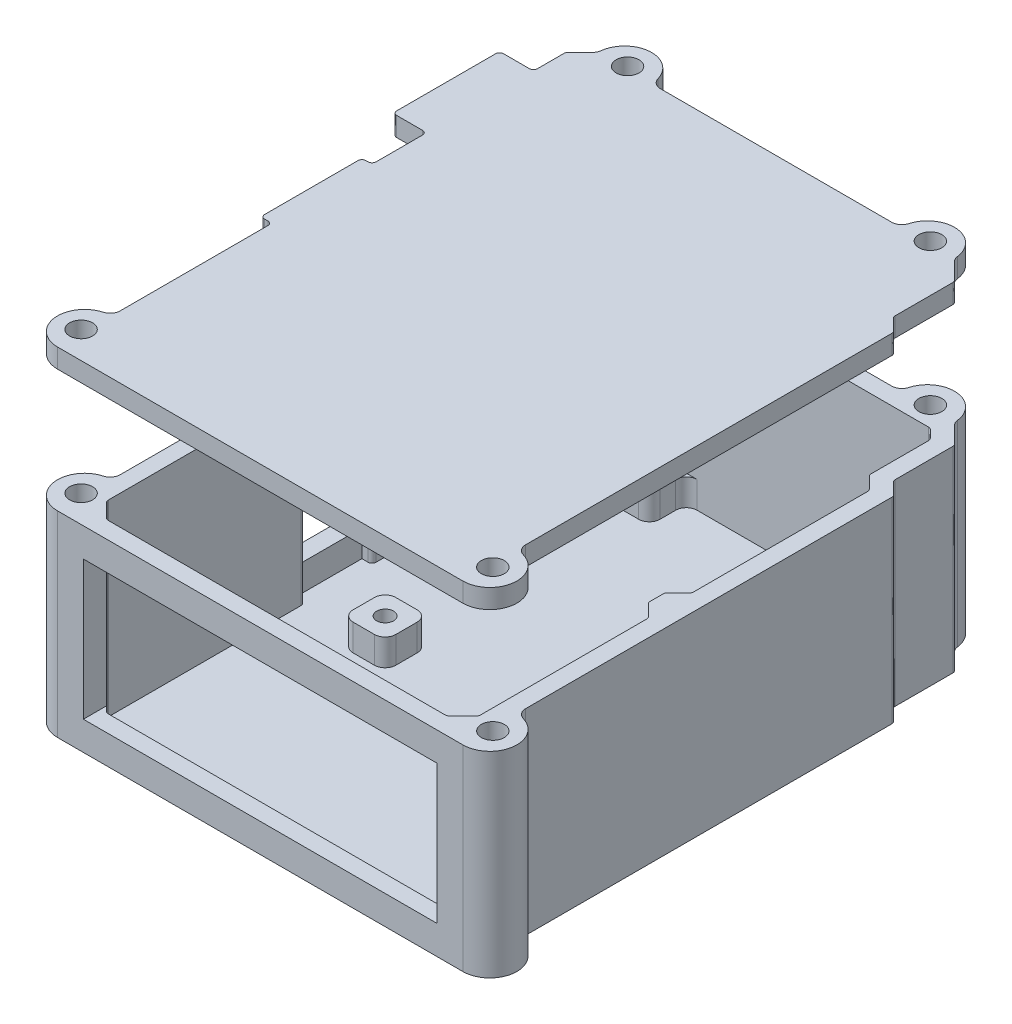
from build123d import *

# Parameters (mm, degrees)
BOSS_EXTRUDE1_DEPTH            = 1.600000102
BOSS_EXTRUDE2_START            = 1.6
BOSS_EXTRUDE2_DEPTH            = 35.199999704
SKETCH7_W                      = 7.60000004
SKETCH7_H                      = 7.60000004
SKETCH7_W_2                    = 8.000000002
SKETCH7_H_2                    = 8.000000002
BOSS_EXTRUDE4_DEPTH            = 4.999999906
SKETCH2_R                      = 1.5875
CUT_EXTRUDE3_DEPTH             = 100.287884374
CUT_EXTRUDE1_START             = -7.64499995
CUT_EXTRUDE1_OUTLINE_W         = 13.630000172
CUT_EXTRUDE1_OUTLINE_H         = 12.599999946
CUT_EXTRUDE1_OUTLINE_W_2       = 12.59000022
CUT_EXTRUDE1_DEPTH             = 7.64499995
FILLET1_R                      = 2.000000064
CHAMFER2_SIZE                  = 3
CHAMFER2_SIZE_2                = 2.631851771
CUT_EXTRUDE6_DEPTH             = 2.50000008
FILLET4_R                      = 0.75
CUT_EXTRUDE9_REACH             = 129.607
SKETCH21_W                     = 66.299999918
SKETCH21_H                     = 26.00999998
CUT_EXTRUDE9_DIRECTION_2_DEPTH = 2.54
SKETCH23_R                     = 2.150000018
BOSS_EXTRUDE14_DEPTH           = 36.799999806
CUT_EXTRUDE10_START            = -36.8
CUT_EXTRUDE10_DEPTH            = 10.000000066
FILLET5_R                      = 1.905
SKETCH24_R                     = 2.150000018
BOSS_EXTRUDE15_DEPTH           = 1.199999886
BOSS_EXTRUDE16_DEPTH           = 4.800000052
BOSS_EXTRUDE17_START           = -2.400000026
BOSS_EXTRUDE17_OUTLINE_R       = 2.150000018
BOSS_EXTRUDE17_DEPTH           = 2.400000026
FILLET6_R                      = 1.27


with BuildPart() as part:
    # Sketch3 → Boss-Extrude1 (new body)
    with BuildSketch(Plane(origin=(0, 0, 0), x_dir=(1, 0, 0), z_dir=(0, 1, 0))):
        Polygon((72.38000002, -41.29999995), (72.38000002, 3.505988455), (72.38000002, 39.420011545), (69.84000002, 41.960011545), (69.84000002, 53.390011545), (66.090011545, 57.14000002), (-3.80000002, 57.14000002), (-3.80000002, 48.115000036), (-10.15000002, 48.115000036), (-10.15000002, 28.084999964), (-3.80000002, 28.084999964), (-3.80000002, 17.865000084), (-5.70500002, 17.865000084), (-5.70500002, -1.125000036), (-3.595726125, -1.125000036), (-3.595726125, -41.29999995), align=None)
    extrude(amount=BOSS_EXTRUDE1_DEPTH)

    # Sketch3<3> → Boss-Extrude2 (add)
    with BuildSketch(Plane(origin=(0, 0, 0), x_dir=(1, 0, 0), z_dir=(0, 1, 0)).offset(BOSS_EXTRUDE2_START)):
        Polygon((72.38000002, 3.505988455), (72.38000002, -41.29999995), (-3.595726125, -41.29999995), (-3.595726125, -1.125000036), (-5.70500002, -1.125000036), (-5.70500002, 17.865000084), (-3.80000002, 17.865000084), (-3.80000002, 28.084999964), (-10.15000002, 28.084999964), (-10.15000002, 48.115000036), (-3.80000002, 48.115000036), (-3.80000002, 57.14000002), (66.090011545, 57.14000002), (69.84000002, 53.390011545), (69.84000002, 41.960011545), (72.38000002, 39.420011545), align=None)
        Polygon((69.18000007, -0.315998005), (69.18000007, -38.1), (-0.60000007, -38.1), (-0.60000007, 0), (-0.60000007, 2.074999914), (-2.50500007, 2.074999914), (-2.50500007, 14.665000134), (-0.60000007, 14.665000134), (-0.60000007, 31.284999914), (-6.95000007, 31.284999914), (-6.95000007, 44.915000086), (-0.60000007, 44.915000086), (-0.60000007, 53.94000007), (64.764528166, 53.94000007), (66.64000007, 52.064528166), (66.64000007, 40.634528166), (69.18000007, 38.094528166), (69.18000007, 4.831471834), (66.64000007, 2.291471834), (66.64000007, 0), (66.64000007, -0.705067354), align=None, mode=Mode.SUBTRACT)
    extrude(amount=BOSS_EXTRUDE2_DEPTH)

    # Sketch7 → Boss-Extrude4 (add)
    with BuildSketch(Plane(origin=(0, 1.600000102, 0), x_dir=(1, 0, 0), z_dir=(0, 1, 0))):
        with Locations((15.24, 50.8)):
            Rectangle(SKETCH7_W, SKETCH7_H)
        with Locations((66.04, 35.56)):
            Rectangle(SKETCH7_W_2, SKETCH7_H_2)
        with Locations((66.04, 7.62)):
            Rectangle(SKETCH7_W_2, SKETCH7_H_2)
        with Locations((13.97, 2.54)):
            Rectangle(SKETCH7_W_2, SKETCH7_H_2)
    extrude(amount=BOSS_EXTRUDE4_DEPTH)

    # Sketch2 → Cut-Extrude3 (cut, through all)
    with BuildSketch(Plane(origin=(0, 0, 0), x_dir=(1, 0, 0), z_dir=(0, 1, 0))):
        with Locations(Location((13.97, 2.54, 0), (0, 0, 90))):
            Circle(SKETCH2_R)
        with Locations(Location((15.24, 50.8, 0), (0, 0, 270))):
            Circle(SKETCH2_R)
        with Locations(Location((66.04, 35.56, 0), (0, 0, 90))):
            Circle(SKETCH2_R)
        with Locations(Location((66.04, 7.62, 0), (0, 0, 270))):
            Circle(SKETCH2_R)
    extrude(amount=CUT_EXTRUDE3_DEPTH, mode=Mode.SUBTRACT)

    # Cut-Extrude1: read off the stored shape, not the designer's step
    # Cut-Extrude1 outline → Cut-Extrude1 (cut)
    with BuildSketch(Plane(origin=(-2.50500007, 0, 0), x_dir=(0, 0, -1), z_dir=(1, 0, 0)).offset(CUT_EXTRUDE1_START)):
        with Locations((38.1, 12.899999981)):
            Rectangle(CUT_EXTRUDE1_OUTLINE_W, CUT_EXTRUDE1_OUTLINE_H)
        with Locations((8.370000024, 12.899999981)):
            Rectangle(CUT_EXTRUDE1_OUTLINE_W_2, CUT_EXTRUDE1_OUTLINE_H)
    extrude(amount=CUT_EXTRUDE1_DEPTH, mode=Mode.SUBTRACT)

    # Fillet1
    # the kernel refuses this fillet: 2.000000064 mm, written as the material it adds along each edge
    with BuildSketch(Plane(origin=(69.18000007, 1.600000102, -31.559999999), x_dir=(0, 0, 1), z_dir=(0, 1, 0))) as fillet1_piece_1:
        with BuildLine():
            CenterArc((FILLET1_R, -FILLET1_R), FILLET1_R, 90, 90)
            Line((0, -FILLET1_R), (0, 0))
            Line((0, 0), (FILLET1_R, 0))
        make_face()
    extrude(amount=4.999999906)
    with BuildSketch(Plane(origin=(69.18000007, 1.600000102, -11.620000001), x_dir=(0, 0, -1), z_dir=(0, 1, 0)), Plane(origin=(19.04000002, 6.600000008, -53.94000007), x_dir=(1, 0, 0), z_dir=(0, -1, 0)), Plane(origin=(11.43999998, 1.600000102, -53.94000007), x_dir=(-1, 0, 0), z_dir=(0, 1, 0))) as fillet1_piece_2:
        with BuildLine():
            CenterArc((FILLET1_R, FILLET1_R), FILLET1_R, 180, 90)
            Line((0, FILLET1_R), (0, 0))
            Line((0, 0), (FILLET1_R, 0))
        make_face()
    extrude(amount=4.999999906)
    with BuildSketch(Plane(origin=(67.968528235, 6.600000008, -3.619999999), x_dir=(-0.7071067811877789, 0, 0.707106781185316), z_dir=(0, -1, 0))) as fillet1_piece_3:
        with BuildLine():
            CenterArc((3.685752081, 0.857324866), FILLET1_R, 135, 70.382703807)
            Line((2.271538473, 2.271538473), (0, 0))
            Line((0, 0), (1.87882255, 0))
        make_face()
    extrude(amount=4.999999906)
    with BuildSketch(Plane(origin=(67.714528235, 6.600000008, -39.560000001), x_dir=(-0.7071067811865499, 0, -0.7071067811865452), z_dir=(0, -1, 0))) as fillet1_piece_4:
        with BuildLine():
            CenterArc((3.427714703, -0.599287488), FILLET1_R, 162.563793754, 62.436206246)
            Line((2.013501095, -2.013501095), (0, 0))
            Line((0, 0), (1.519612305, 0))
        make_face()
    extrude(amount=4.999999906)
    # the kernel refuses this fillet: 2.000000064 mm, written as the material it takes off along each edge
    with BuildSketch(Plane(origin=(19.04000002, 1.600000102, -46.99999998), x_dir=(0, 0, -1), z_dir=(0, 1, 0)), Plane(origin=(11.43999998, 1.600000102, -46.99999998), x_dir=(1, 0, 0), z_dir=(0, 1, 0)), Plane(origin=(9.969999999, 1.600000102, -6.540000001), x_dir=(0, 0, 1), z_dir=(0, 1, 0)), Plane(origin=(62.039999999, 1.600000102, -3.619999999), x_dir=(1, 0, 0), z_dir=(0, 1, 0)), Plane(origin=(62.039999999, 1.600000102, -11.620000001), x_dir=(0, 0, 1), z_dir=(0, 1, 0)), Plane(origin=(62.039999999, 1.600000102, -31.559999999), x_dir=(1, 0, 0), z_dir=(0, 1, 0)), Plane(origin=(9.969999999, 1.600000102, 1.460000001), x_dir=(1, 0, 0), z_dir=(0, 1, 0))) as fillet1_2_piece_1:
        with BuildLine():
            CenterArc((FILLET1_R, FILLET1_R), FILLET1_R, 180, 90)
            Line((0, FILLET1_R), (0, 0))
            Line((0, 0), (FILLET1_R, 0))
        make_face()
    extrude(amount=10.000000066, mode=Mode.SUBTRACT)
    with BuildSketch(Plane(origin=(17.970000001, 1.600000102, -6.540000001), x_dir=(0, 0, 1), z_dir=(0, 1, 0)), Plane(origin=(62.039999999, 1.600000102, -39.560000001), x_dir=(1, 0, 0), z_dir=(0, 1, 0)), Plane(origin=(17.970000001, 1.600000102, 1.460000001), x_dir=(-1, 0, 0), z_dir=(0, 1, 0))) as fillet1_2_piece_2:
        with BuildLine():
            CenterArc((FILLET1_R, -FILLET1_R), FILLET1_R, 90, 90)
            Line((0, -FILLET1_R), (0, 0))
            Line((0, 0), (FILLET1_R, 0))
        make_face()
    extrude(amount=10.000000066, mode=Mode.SUBTRACT)

    # Chamfer2
    # the kernel refuses this chamfer: 3, 2.631851771 mm, written as the material it adds along each edge
    with BuildSketch(Plane(origin=(-0.60000007, -6.115048964, 38.1), x_dir=(0, 0, -1), z_dir=(0, 1, 0))) as chamfer2_piece_1_section:
        Polygon((CHAMFER2_SIZE, 0), (0, -CHAMFER2_SIZE), (0, 0), align=None)
    chamfer2_piece_1 = extrude(amount=42.915048668, mode=Mode.PRIVATE)
    chamfer2_piece_1 = split(chamfer2_piece_1, bisect_by=Plane(origin=(-0.60000007, 1.600000102, 38.1), z_dir=(0, 1, 0)), keep=Keep.TOP, mode=Mode.PRIVATE)
    add(chamfer2_piece_1)
    with BuildSketch(Plane(origin=(69.18000007, -6.115048964, 38.1), x_dir=(0, 0, -1), z_dir=(0, 1, 0))) as chamfer2_piece_2_section:
        Polygon((CHAMFER2_SIZE, 0), (0, CHAMFER2_SIZE), (0, 0), align=None)
    chamfer2_piece_2 = extrude(amount=42.915048668, mode=Mode.PRIVATE)
    chamfer2_piece_2 = split(chamfer2_piece_2, bisect_by=Plane(origin=(69.18000007, 1.600000102, 38.1), z_dir=(0, 1, 0)), keep=Keep.TOP, mode=Mode.PRIVATE)
    add(chamfer2_piece_2)
    with BuildSketch(Plane(origin=(69.18000007, -6.115048964, 0.315998005), x_dir=(0, 0, 1), z_dir=(0, 1, 0))) as chamfer2_piece_3_section:
        Polygon((CHAMFER2_SIZE, 0), (CHAMFER2_SIZE_2 * 0.151410918199, -CHAMFER2_SIZE_2 * 0.988470906855), (0, 0), align=None)
    chamfer2_piece_3 = extrude(amount=42.915048668, mode=Mode.PRIVATE)
    chamfer2_piece_3 = split(chamfer2_piece_3, bisect_by=Plane(origin=(69.18000007, 1.600000102, 0.315998005), z_dir=(0, 1, 0)), keep=Keep.TOP, mode=Mode.PRIVATE)
    chamfer2_piece_3 = split(chamfer2_piece_3, bisect_by=Plane(origin=(66.64000007, -6.115048964, 0.315998005), z_dir=(1, 0, 0)), keep=Keep.TOP, mode=Mode.PRIVATE)
    add(chamfer2_piece_3)
    # the kernel refuses this chamfer: 3, 2.631851771 mm, written as the material it takes off along each edge
    with BuildSketch(Plane(origin=(-3.80000002, -7.715048964, -57.14000002), x_dir=(0, 0, 1), z_dir=(0, 1, 0))) as chamfer2_2_piece_1:
        Polygon((CHAMFER2_SIZE, 0), (0, CHAMFER2_SIZE), (0, 0), align=None)
    extrude(amount=52.230097632, mode=Mode.SUBTRACT)

    # Sketch15 → Cut-Extrude6 (cut)
    with BuildSketch(Plane.XZ):
        Polygon((13.97, 0.60655898), (11.244999989, -0.96672051), (11.244999989, -4.11327949), (13.97, -5.68655898), (16.695000011, -4.11327949), (16.695000011, -0.96672051), align=None)
        Polygon((66.04, -4.47344102), (63.314999989, -6.04672051), (63.314999989, -9.19327949), (66.04, -10.76655898), (68.765000011, -9.19327949), (68.765000011, -6.04672051), align=None)
        Polygon((66.04, -32.41344102), (63.314999989, -33.98672051), (63.314999989, -37.13327949), (66.04, -38.70655898), (68.765000011, -37.13327949), (68.765000011, -33.98672051), align=None)
        Polygon((15.24, -47.65344102), (12.514999989, -49.22672051), (12.514999989, -52.37327949), (15.24, -53.94655898), (17.965000011, -52.37327949), (17.965000011, -49.22672051), align=None)
    extrude(amount=-CUT_EXTRUDE6_DEPTH, mode=Mode.SUBTRACT)

    # Fillet4
    fillet4_edges = [part.edges().sort_by_distance(p)[0] for p in [
        (-3.595726125, 18.399999852, 1.125000036),
        (-5.70500002, 18.399999852, 1.125000036),
        (-5.70500002, 18.399999852, -17.865000084),
        (-3.80000002, 18.399999852, -17.865000084),
        (-3.80000002, 18.399999852, -28.084999964),
        (-10.15000002, 18.399999852, -28.084999964),
        (-10.15000002, 18.399999852, -48.115000036),
        (-3.80000002, 18.399999852, -48.115000036),
        (69.84000002, 18.399999852, -53.390011545),
        (69.84000002, 18.399999852, -41.960011545),
        (72.38000002, 18.399999852, -39.420011545),
        (-3.80000002, 18.399999852, -54.14000002),
        (69.18000007, 19.199999903, 35.1),
        (69.18000007, 19.199999903, 3.315998005),
        (2.39999993, 19.199999903, 38.1),
        (66.18000007, 19.199999903, 38.1),
        (-0.60000007, 19.199999903, 35.1),
        (66.64000007, 19.199999903, 0.775998005),
        (66.64000007, 21.699999856, -2.291471834),
        (69.18000007, 21.699999856, -4.831471834),
        (69.18000007, 21.699999856, -38.094528166),
        (66.64000007, 21.699999856, -40.634528166),
        (66.64000007, 19.199999852, -52.064528166),
        (64.764528166, 19.199999852, -53.94000007),
        (-0.60000007, 19.199999852, -53.94000007),
        (-0.60000007, 19.199999852, -44.915000086),
        (-0.60000007, 19.199999852, -31.284999914),
        (-0.60000007, 19.199999852, -14.665000134),
        (-0.60000007, 19.199999852, -2.074999914),
    ]]
    fillet(fillet4_edges, radius=FILLET4_R)

    # Sketch21 → Cut-Extrude9 (cut, up to next)
    with BuildSketch(Plane.XY.offset(41.29999995), mode=Mode.PRIVATE) as cut_extrude9_sk1:
        with Locations((34.392136947, 18.399999903)):
            Rectangle(SKETCH21_W, SKETCH21_H)
    cut_extrude9_tool1 = extrude(cut_extrude9_sk1.sketch, amount=-CUT_EXTRUDE9_REACH, mode=Mode.PRIVATE) & part.part
    add(cut_extrude9_tool1.solids().sort_by_distance((34.392137, 18.4, 41.3))[0], mode=Mode.SUBTRACT)

    # Sketch21 → Cut-Extrude9 direction 2 (cut)
    with BuildSketch(Plane.XY.offset(41.29999995)):
        with Locations((34.392136947, 18.399999903)):
            Rectangle(SKETCH21_W, SKETCH21_H)
    extrude(amount=CUT_EXTRUDE9_DIRECTION_2_DEPTH, mode=Mode.SUBTRACT)

    # Sketch23 → Boss-Extrude14 (add)
    with BuildSketch(Plane.XZ):
        with Locations((4.263000014, -57.690000063)):
            Circle(SKETCH23_R)
        with BuildLine():
            Line((-0.80000002, -57.14000002), (9.326000048, -57.14000002))
            ThreePointArc((9.326000048, -57.14000002), (4.263000014, -62.203000054), (-0.80000002, -57.14000002))
        make_face()
        with BuildLine():
            ThreePointArc((6.34146099, -57.14000002), (4.263000014, -55.540000045), (2.184539038, -57.14000002))
            Line((2.184539038, -57.14000002), (6.34146099, -57.14000002))
        make_face()
        with BuildLine():
            Line((6.34146099, -57.14000002), (2.184539038, -57.14000002))
            ThreePointArc((2.184539038, -57.14000002), (3.985683461, -59.822040308), (6.413000032, -57.690000063))
            ThreePointArc((6.413000032, -57.690000063), (6.395040259, -57.41268351), (6.34146099, -57.14000002))
        make_face()
        with BuildLine():
            ThreePointArc((63.105472488, -57.14000002), (61.027011511, -55.540000045), (58.948550535, -57.14000002))
            Line((58.948550535, -57.14000002), (63.105472488, -57.14000002))
        make_face()
        with BuildLine():
            Line((63.105472488, -57.14000002), (58.948550535, -57.14000002))
            ThreePointArc((58.948550535, -57.14000002), (60.749694959, -59.822040308), (63.177011529, -57.690000063))
            ThreePointArc((63.177011529, -57.690000063), (63.159051756, -57.41268351), (63.105472488, -57.14000002))
        make_face()
        with Locations((61.027011511, -57.690000063)):
            Circle(SKETCH23_R)
        with BuildLine():
            Line((55.964011477, -57.14000002), (66.090011545, -57.14000002))
            ThreePointArc((66.090011545, -57.14000002), (61.027011511, -62.203000054), (55.964011477, -57.14000002))
        make_face()
        with BuildLine():
            ThreePointArc((75.080000081, 36.236999916), (74.241487763, 37.940672446), (72.38000002, 38.315460892))
            Line((72.38000002, 38.315460892), (72.38000002, 34.15853894))
            ThreePointArc((72.38000002, 34.15853894), (74.241487763, 34.533327386), (75.080000081, 36.236999916))
        make_face()
        with BuildLine():
            Line((72.38000002, 34.15853894), (72.38000002, 38.315460892))
            ThreePointArc((72.38000002, 38.315460892), (70.780000045, 36.236999916), (72.38000002, 34.15853894))
        make_face()
        with Locations((72.930000063, 36.236999916)):
            Circle(SKETCH23_R)
        with BuildLine():
            Line((72.38000002, 41.29999995), (72.38000002, 31.173999882))
            ThreePointArc((72.38000002, 31.173999882), (77.443000054, 36.236999916), (72.38000002, 41.29999995))
        make_face()
        with Locations((-4.247863116, 36.236999916)):
            Circle(SKETCH23_R)
        with BuildLine():
            Line((-3.595726125, 41.29999995), (-3.595726125, 31.173999882))
            ThreePointArc((-3.595726125, 31.173999882), (-8.658726159, 36.236999916), (-3.595726125, 41.29999995))
        make_face()
        with BuildLine():
            ThreePointArc((-2.097863098, 36.236999916), (-2.512266011, 37.505937569), (-3.595726125, 38.285711078))
            Line((-3.595726125, 38.285711078), (-3.595726125, 34.188288754))
            ThreePointArc((-3.595726125, 34.188288754), (-2.512266011, 34.968062263), (-2.097863098, 36.236999916))
        make_face()
        with BuildLine():
            Line((-3.595726125, 34.188288754), (-3.595726125, 38.285711078))
            ThreePointArc((-3.595726125, 38.285711078), (-6.397863134, 36.236999916), (-3.595726125, 34.188288754))
        make_face()
    extrude(amount=-BOSS_EXTRUDE14_DEPTH)

    # Sketch23<3> → Cut-Extrude10 (cut)
    with BuildSketch(Plane.XZ.offset(CUT_EXTRUDE10_START)):
        with BuildLine():
            ThreePointArc((6.34146099, -57.14000002), (4.263000014, -55.540000045), (2.184539038, -57.14000002))
            Line((2.184539038, -57.14000002), (6.34146099, -57.14000002))
        make_face()
        with BuildLine():
            Line((6.34146099, -57.14000002), (2.184539038, -57.14000002))
            ThreePointArc((2.184539038, -57.14000002), (3.985683461, -59.822040308), (6.413000032, -57.690000063))
            ThreePointArc((6.413000032, -57.690000063), (6.395040259, -57.41268351), (6.34146099, -57.14000002))
        make_face()
        with BuildLine():
            ThreePointArc((63.105472488, -57.14000002), (61.027011511, -55.540000045), (58.948550535, -57.14000002))
            Line((58.948550535, -57.14000002), (63.105472488, -57.14000002))
        make_face()
        with BuildLine():
            Line((63.105472488, -57.14000002), (58.948550535, -57.14000002))
            ThreePointArc((58.948550535, -57.14000002), (60.749694959, -59.822040308), (63.177011529, -57.690000063))
            ThreePointArc((63.177011529, -57.690000063), (63.159051756, -57.41268351), (63.105472488, -57.14000002))
        make_face()
        with BuildLine():
            ThreePointArc((75.080000081, 36.236999916), (74.241487763, 37.940672446), (72.38000002, 38.315460892))
            Line((72.38000002, 38.315460892), (72.38000002, 34.15853894))
            ThreePointArc((72.38000002, 34.15853894), (74.241487763, 34.533327386), (75.080000081, 36.236999916))
        make_face()
        with BuildLine():
            Line((72.38000002, 34.15853894), (72.38000002, 38.315460892))
            ThreePointArc((72.38000002, 38.315460892), (70.780000045, 36.236999916), (72.38000002, 34.15853894))
        make_face()
        with BuildLine():
            ThreePointArc((-2.097863098, 36.236999916), (-2.512266011, 37.505937569), (-3.595726125, 38.285711078))
            Line((-3.595726125, 38.285711078), (-3.595726125, 34.188288754))
            ThreePointArc((-3.595726125, 34.188288754), (-2.512266011, 34.968062263), (-2.097863098, 36.236999916))
        make_face()
        with BuildLine():
            Line((-3.595726125, 34.188288754), (-3.595726125, 38.285711078))
            ThreePointArc((-3.595726125, 38.285711078), (-6.397863134, 36.236999916), (-3.595726125, 34.188288754))
        make_face()
    extrude(amount=CUT_EXTRUDE10_DEPTH, mode=Mode.SUBTRACT)

    # Fillet5
    fillet5_edges = [part.edges().sort_by_distance(p)[0] for p in [
        (66.090011545, 18.399999852, -57.14000002),
        (-0.80000002, 18.399999852, -57.14000002),
        (9.326000048, 18.399999903, -57.14000002),
        (55.964011477, 18.399999903, -57.14000002),
        (72.38000002, 18.399999903, 31.173999882),
        (-3.595726125, 18.399999903, 31.173999882),
    ]]
    fillet(fillet5_edges, radius=FILLET5_R)


with BuildPart() as body_2:
    # Sketch24 → Boss-Extrude15 (new body)
    with BuildSketch(Plane(origin=(0, 62.199999806, 0), x_dir=(1, 0, 0), z_dir=(0, 1, 0))):
        with BuildLine():
            Line((-3.595726125, -41.29999995), (72.38000002, -41.29999995))
            ThreePointArc((72.38000002, -41.29999995), (77.394546314, -36.935780864), (73.76418702, -31.366887423))
            ThreePointArc((73.76418702, -31.366887423), (72.764938547, -30.682695728), (72.38000002, -29.534463122))
            Line((72.38000002, -29.534463122), (72.38000002, 39.109351374))
            ThreePointArc((72.38000002, 39.109351374), (72.322909669, 39.396363948), (72.160330106, 39.639681459))
            Line((72.160330106, 39.639681459), (70.059669934, 41.740341631))
            ThreePointArc((70.059669934, 41.740341631), (69.897090371, 41.983659143), (69.84000002, 42.270671717))
            Line((69.84000002, 42.270671717), (69.84000002, 53.079351374))
            ThreePointArc((69.84000002, 53.079351374), (69.782909669, 53.366363948), (69.620330106, 53.609681459))
            Line((69.620330106, 53.609681459), (66.597171076, 56.63284049))
            ThreePointArc((66.597171076, 56.63284049), (66.231445389, 57.145933993), (66.053098401, 57.750262192))
            ThreePointArc((66.053098401, 57.750262192), (61.421754355, 62.187588299), (56.156899018, 58.52418702))
            ThreePointArc((56.156899018, 58.52418702), (55.472707323, 57.524938547), (54.324474717, 57.14000002))
            Line((54.324474717, 57.14000002), (10.965536808, 57.14000002))
            ThreePointArc((10.965536808, 57.14000002), (9.817304202, 57.524938547), (9.133112507, 58.52418702))
            ThreePointArc((9.133112507, 58.52418702), (3.86825717, 62.187588299), (-0.763086876, 57.750262192))
            ThreePointArc((-0.763086876, 57.750262192), (-0.941433864, 57.145933993), (-1.30715955, 56.63284049))
            Line((-1.30715955, 56.63284049), (-3.580330106, 54.359669934))
            ThreePointArc((-3.580330106, 54.359669934), (-3.742909669, 54.116352422), (-3.80000002, 53.829339848))
            Line((-3.80000002, 53.829339848), (-3.80000002, 48.865000036))
            ThreePointArc((-3.80000002, 48.865000036), (-4.019669934, 48.33466995), (-4.55000002, 48.115000036))
            Line((-4.55000002, 48.115000036), (-9.40000002, 48.115000036))
            ThreePointArc((-9.40000002, 48.115000036), (-9.930330106, 47.895330122), (-10.15000002, 47.365000036))
            Line((-10.15000002, 47.365000036), (-10.15000002, 28.834999964))
            ThreePointArc((-10.15000002, 28.834999964), (-9.930330106, 28.304669878), (-9.40000002, 28.084999964))
            Line((-9.40000002, 28.084999964), (-4.55000002, 28.084999964))
            ThreePointArc((-4.55000002, 28.084999964), (-4.019669934, 27.86533005), (-3.80000002, 27.334999964))
            Line((-3.80000002, 27.334999964), (-3.80000002, 18.615000084))
            ThreePointArc((-3.80000002, 18.615000084), (-4.019669934, 18.084669998), (-4.55000002, 17.865000084))
            Line((-4.55000002, 17.865000084), (-4.95500002, 17.865000084))
            ThreePointArc((-4.95500002, 17.865000084), (-5.485330106, 17.64533017), (-5.70500002, 17.115000084))
            Line((-5.70500002, 17.115000084), (-5.70500002, -0.375000036))
            ThreePointArc((-5.70500002, -0.375000036), (-5.485330106, -0.905330122), (-4.95500002, -1.125000036))
            Line((-4.95500002, -1.125000036), (-4.345726125, -1.125000036))
            ThreePointArc((-4.345726125, -1.125000036), (-3.81539604, -1.34466995), (-3.595726125, -1.875000036))
            Line((-3.595726125, -1.875000036), (-3.595726125, -29.534463122))
            ThreePointArc((-3.595726125, -29.534463122), (-3.980664652, -30.682695728), (-4.979913126, -31.366887423))
            ThreePointArc((-4.979913126, -31.366887423), (-8.610272419, -36.935780864), (-3.595726125, -41.29999995))
        make_face()
        with Locations(Location((72.930000063, -36.236999916, 0), (0, 0, 270))):
            Circle(SKETCH24_R, mode=Mode.SUBTRACT)
        with Locations(Location((-4.247863116, -36.236999916, 0), (0, 0, 270))):
            Circle(SKETCH24_R, mode=Mode.SUBTRACT)
        with Locations(Location((61.027011511, 57.690000063, 0), (0, 0, 270))):
            Circle(SKETCH24_R, mode=Mode.SUBTRACT)
        with Locations(Location((4.263000014, 57.690000063, 0), (0, 0, 270))):
            Circle(SKETCH24_R, mode=Mode.SUBTRACT)
    extrude(amount=BOSS_EXTRUDE15_DEPTH)

    # Sketch24<3> → Boss-Extrude16 (add)
    with BuildSketch(Plane(origin=(0, 62.199999806, 0), x_dir=(1, 0, 0), z_dir=(0, 1, 0))):
        with BuildLine():
            Line((64.453867995, 53.64000007), (0.14999993, 53.64000007))
            ThreePointArc((0.14999993, 53.64000007), (-0.168198122, 53.508198122), (-0.30000007, 53.19000007))
            Line((-0.30000007, 53.19000007), (-0.30000007, 45.665000086))
            ThreePointArc((-0.30000007, 45.665000086), (-0.60753795, 44.922537966), (-1.35000007, 44.615000086))
            Line((-1.35000007, 44.615000086), (-6.65000007, 44.615000086))
            Line((-6.65000007, 44.615000086), (-6.65000007, 31.584999914))
            Line((-6.65000007, 31.584999914), (-1.35000007, 31.584999914))
            ThreePointArc((-1.35000007, 31.584999914), (-0.60753795, 31.277462034), (-0.30000007, 30.534999914))
            Line((-0.30000007, 30.534999914), (-0.30000007, 15.415000134))
            ThreePointArc((-0.30000007, 15.415000134), (-0.60753795, 14.672538014), (-1.35000007, 14.365000134))
            Line((-1.35000007, 14.365000134), (-2.20500007, 14.365000134))
            Line((-2.20500007, 14.365000134), (-2.20500007, 2.374999914))
            Line((-2.20500007, 2.374999914), (-1.35000007, 2.374999914))
            ThreePointArc((-1.35000007, 2.374999914), (-0.60753795, 2.067462034), (-0.30000007, 1.324999914))
            Line((-0.30000007, 1.324999914), (-0.30000007, -34.789339828))
            ThreePointArc((-0.30000007, -34.789339828), (-0.26574586, -34.961547373), (-0.168198122, -35.10753788))
            Line((-0.168198122, -35.10753788), (2.39246205, -37.668198052))
            ThreePointArc((2.39246205, -37.668198052), (2.538452557, -37.76574579), (2.710660102, -37.8))
            Line((2.710660102, -37.8), (65.869339898, -37.8))
            ThreePointArc((65.869339898, -37.8), (66.041547443, -37.76574579), (66.18753795, -37.668198052))
            Line((66.18753795, -37.668198052), (68.748198122, -35.10753788))
            ThreePointArc((68.748198122, -35.10753788), (68.84574586, -34.961547373), (68.88000007, -34.789339828))
            Line((68.88000007, -34.789339828), (68.88000007, -3.626658177))
            ThreePointArc((68.88000007, -3.626658177), (68.84574586, -3.454450632), (68.748198122, -3.308460126))
            Line((68.748198122, -3.308460126), (66.64753795, -1.207799954))
            ThreePointArc((66.64753795, -1.207799954), (66.419926561, -0.867155437), (66.34000007, -0.465337834))
            Line((66.34000007, -0.465337834), (66.34000007, 1.980811662))
            ThreePointArc((66.34000007, 1.980811662), (66.419926561, 2.382629266), (66.64753795, 2.723273782))
            Line((66.64753795, 2.723273782), (68.748198122, 4.823933954))
            ThreePointArc((68.748198122, 4.823933954), (68.84574586, 4.969924461), (68.88000007, 5.142132005))
            Line((68.88000007, 5.142132005), (68.88000007, 37.783867995))
            ThreePointArc((68.88000007, 37.783867995), (68.84574586, 37.956075539), (68.748198122, 38.102066046))
            Line((68.748198122, 38.102066046), (66.64753795, 40.202726218))
            ThreePointArc((66.64753795, 40.202726218), (66.419926561, 40.543370734), (66.34000007, 40.945188338))
            Line((66.34000007, 40.945188338), (66.34000007, 51.753867995))
            ThreePointArc((66.34000007, 51.753867995), (66.30574586, 51.926075539), (66.208198122, 52.072066046))
            Line((66.208198122, 52.072066046), (64.772066046, 53.508198122))
            ThreePointArc((64.772066046, 53.508198122), (64.626075539, 53.60574586), (64.453867995, 53.64000007))
        make_face()
        with BuildLine():
            Line((63.977522398, 52.04000007), (1.29999993, 52.04000007))
            Line((1.29999993, 52.04000007), (1.29999993, 45.665000086))
            ThreePointArc((1.29999993, 45.665000086), (0.5238329, 43.791167116), (-1.35000007, 43.015000086))
            Line((-1.35000007, 43.015000086), (-5.05000007, 43.015000086))
            Line((-5.05000007, 43.015000086), (-5.05000007, 33.184999914))
            Line((-5.05000007, 33.184999914), (-1.35000007, 33.184999914))
            ThreePointArc((-1.35000007, 33.184999914), (0.5238329, 32.408832884), (1.29999993, 30.534999914))
            Line((1.29999993, 30.534999914), (1.29999993, 15.415000134))
            ThreePointArc((1.29999993, 15.415000134), (0.770937223, 13.826250626), (-0.60500007, 12.871877054))
            Line((-0.60500007, 12.871877054), (-0.60500007, 3.868122994))
            ThreePointArc((-0.60500007, 3.868122994), (0.770937223, 2.913749422), (1.29999993, 1.324999914))
            Line((1.29999993, 1.324999914), (1.29999993, -34.312994231))
            Line((1.29999993, -34.312994231), (3.187005699, -36.2))
            Line((3.187005699, -36.2), (65.392994301, -36.2))
            Line((65.392994301, -36.2), (67.28000007, -34.312994231))
            Line((67.28000007, -34.312994231), (67.28000007, -4.103003774))
            Line((67.28000007, -4.103003774), (65.5161671, -2.339170804))
            ThreePointArc((65.5161671, -2.339170804), (64.941719309, -1.479448929), (64.74000007, -0.465337834))
            Line((64.74000007, -0.465337834), (64.74000007, 1.980811662))
            ThreePointArc((64.74000007, 1.980811662), (64.941719309, 2.994922758), (65.5161671, 3.854644632))
            Line((65.5161671, 3.854644632), (67.28000007, 5.618477602))
            Line((67.28000007, 5.618477602), (67.28000007, 37.307522398))
            Line((67.28000007, 37.307522398), (65.5161671, 39.071355368))
            ThreePointArc((65.5161671, 39.071355368), (64.941719309, 39.931077242), (64.74000007, 40.945188338))
            Line((64.74000007, 40.945188338), (64.74000007, 51.277522398))
            Line((64.74000007, 51.277522398), (63.977522398, 52.04000007))
        make_face(mode=Mode.SUBTRACT)
    extrude(amount=-BOSS_EXTRUDE16_DEPTH)

    # Boss-Extrude17: read off the stored shape, not the designer's step
    # Boss-Extrude17 outline → Boss-Extrude17 (add)
    with BuildSketch(Plane(origin=(0, 62.199999806, 0), x_dir=(1, 0, 0), z_dir=(0, 1, 0)).offset(BOSS_EXTRUDE17_START)):
        with BuildLine():
            ThreePointArc((-4.979913126, -31.366887423), (-8.610272419, -36.935780865), (-3.595726125, -41.29999995))
            Line((-3.595726125, -41.29999995), (72.38000002, -41.29999995))
            ThreePointArc((72.38000002, -41.29999995), (77.394546314, -36.935780864), (73.76418702, -31.366887423))
            ThreePointArc((73.76418702, -31.366887423), (72.764938547, -30.682695728), (72.38000002, -29.534463122))
            Line((72.38000002, -29.534463122), (72.38000002, 39.109351374))
            ThreePointArc((72.38000002, 39.109351374), (72.322909669, 39.396363948), (72.160330106, 39.639681459))
            Line((72.160330106, 39.639681459), (70.059669934, 41.740341631))
            ThreePointArc((70.059669934, 41.740341631), (69.897090371, 41.983659143), (69.84000002, 42.270671717))
            Line((69.84000002, 42.270671717), (69.84000002, 53.079351374))
            ThreePointArc((69.84000002, 53.079351374), (69.782909669, 53.366363948), (69.620330106, 53.609681459))
            Line((69.620330106, 53.609681459), (66.597171076, 56.63284049))
            ThreePointArc((66.597171076, 56.63284049), (66.231445389, 57.145933993), (66.053098401, 57.750262192))
            ThreePointArc((66.053098401, 57.750262192), (61.421754355, 62.187588299), (56.156899018, 58.52418702))
            ThreePointArc((56.156899018, 58.52418702), (55.472707323, 57.524938547), (54.324474717, 57.14000002))
            Line((54.324474717, 57.14000002), (10.965536808, 57.14000002))
            ThreePointArc((10.965536808, 57.14000002), (9.817304202, 57.524938547), (9.133112507, 58.52418702))
            ThreePointArc((9.133112507, 58.52418702), (3.86825717, 62.187588299), (-0.763086876, 57.750262192))
            ThreePointArc((-0.763086876, 57.750262192), (-0.941433864, 57.145933993), (-1.30715955, 56.63284049))
            Line((-1.30715955, 56.63284049), (-3.580330106, 54.359669934))
            ThreePointArc((-3.580330106, 54.359669934), (-3.742909669, 54.116352422), (-3.80000002, 53.829339848))
            Line((-3.80000002, 53.829339848), (-3.80000002, 48.865000036))
            ThreePointArc((-3.80000002, 48.865000036), (-4.019669934, 48.33466995), (-4.55000002, 48.115000036))
            Line((-4.55000002, 48.115000036), (-9.40000002, 48.115000036))
            ThreePointArc((-9.40000002, 48.115000036), (-9.930330106, 47.895330122), (-10.15000002, 47.365000036))
            Line((-10.15000002, 47.365000036), (-10.15000002, 28.834999964))
            ThreePointArc((-10.15000002, 28.834999964), (-9.930330106, 28.304669878), (-9.40000002, 28.084999964))
            Line((-9.40000002, 28.084999964), (-4.55000002, 28.084999964))
            ThreePointArc((-4.55000002, 28.084999964), (-4.019669934, 27.86533005), (-3.80000002, 27.334999964))
            Line((-3.80000002, 27.334999964), (-3.80000002, 18.615000084))
            ThreePointArc((-3.80000002, 18.615000084), (-4.019669934, 18.084669998), (-4.55000002, 17.865000084))
            Line((-4.55000002, 17.865000084), (-4.95500002, 17.865000084))
            ThreePointArc((-4.95500002, 17.865000084), (-5.485330106, 17.64533017), (-5.70500002, 17.115000084))
            Line((-5.70500002, 17.115000084), (-5.70500002, -0.375000036))
            ThreePointArc((-5.70500002, -0.375000036), (-5.485330106, -0.905330122), (-4.95500002, -1.125000036))
            Line((-4.95500002, -1.125000036), (-4.345726125, -1.125000036))
            ThreePointArc((-4.345726125, -1.125000036), (-3.815396039, -1.344669951), (-3.595726125, -1.875000036))
            Line((-3.595726125, -1.875000036), (-3.595726125, -29.534463122))
            ThreePointArc((-3.595726125, -29.534463122), (-3.980664652, -30.682695728), (-4.979913126, -31.366887423))
        make_face()
        with Locations((-4.247863116, -36.236999916)):
            Circle(BOSS_EXTRUDE17_OUTLINE_R, mode=Mode.SUBTRACT)
        with BuildLine():
            Line((64.772066046, 53.508198122), (66.208198122, 52.072066046))
            ThreePointArc((66.208198122, 52.072066046), (66.30574586, 51.926075539), (66.34000007, 51.753867995))
            Line((66.34000007, 51.753867995), (66.34000007, 40.945188338))
            ThreePointArc((66.34000007, 40.945188338), (66.419926561, 40.543370734), (66.64753795, 40.202726218))
            Line((66.64753795, 40.202726218), (68.748198122, 38.102066046))
            ThreePointArc((68.748198122, 38.102066046), (68.84574586, 37.956075539), (68.88000007, 37.783867995))
            Line((68.88000007, 37.783867995), (68.88000007, 5.142132005))
            ThreePointArc((68.88000007, 5.142132005), (68.84574586, 4.969924461), (68.748198122, 4.823933954))
            Line((68.748198122, 4.823933954), (66.64753795, 2.723273782))
            ThreePointArc((66.64753795, 2.723273782), (66.419926561, 2.382629266), (66.34000007, 1.980811662))
            Line((66.34000007, 1.980811662), (66.34000007, -0.465337834))
            ThreePointArc((66.34000007, -0.465337834), (66.419926561, -0.867155438), (66.64753795, -1.207799954))
            Line((66.64753795, -1.207799954), (68.748198122, -3.308460126))
            ThreePointArc((68.748198122, -3.308460126), (68.84574586, -3.454450633), (68.88000007, -3.626658177))
            Line((68.88000007, -3.626658177), (68.88000007, -34.789339828))
            ThreePointArc((68.88000007, -34.789339828), (68.84574586, -34.961547373), (68.748198122, -35.10753788))
            Line((68.748198122, -35.10753788), (66.18753795, -37.668198052))
            ThreePointArc((66.18753795, -37.668198052), (66.041547443, -37.76574579), (65.869339898, -37.8))
            Line((65.869339898, -37.8), (2.710660102, -37.8))
            ThreePointArc((2.710660102, -37.8), (2.538452557, -37.76574579), (2.39246205, -37.668198052))
            Line((2.39246205, -37.668198052), (-0.168198122, -35.10753788))
            ThreePointArc((-0.168198122, -35.10753788), (-0.26574586, -34.961547373), (-0.30000007, -34.789339828))
            Line((-0.30000007, -34.789339828), (-0.30000007, 1.324999914))
            ThreePointArc((-0.30000007, 1.324999914), (-0.60753795, 2.067462034), (-1.35000007, 2.374999914))
            Line((-1.35000007, 2.374999914), (-2.20500007, 2.374999914))
            Line((-2.20500007, 2.374999914), (-2.20500007, 14.365000134))
            Line((-2.20500007, 14.365000134), (-1.35000007, 14.365000134))
            ThreePointArc((-1.35000007, 14.365000134), (-0.60753795, 14.672538014), (-0.30000007, 15.415000134))
            Line((-0.30000007, 15.415000134), (-0.30000007, 30.534999914))
            ThreePointArc((-0.30000007, 30.534999914), (-0.60753795, 31.277462034), (-1.35000007, 31.584999914))
            Line((-1.35000007, 31.584999914), (-6.65000007, 31.584999914))
            Line((-6.65000007, 31.584999914), (-6.65000007, 44.615000086))
            Line((-6.65000007, 44.615000086), (-1.35000007, 44.615000086))
            ThreePointArc((-1.35000007, 44.615000086), (-0.60753795, 44.922537966), (-0.30000007, 45.665000086))
            Line((-0.30000007, 45.665000086), (-0.30000007, 53.19000007))
            ThreePointArc((-0.30000007, 53.19000007), (-0.168198122, 53.508198122), (0.14999993, 53.64000007))
            Line((0.14999993, 53.64000007), (64.453867995, 53.64000007))
            ThreePointArc((64.453867995, 53.64000007), (64.626075539, 53.60574586), (64.772066046, 53.508198122))
        make_face(mode=Mode.SUBTRACT)
        with Locations((72.930000063, -36.236999916)):
            Circle(BOSS_EXTRUDE17_OUTLINE_R, mode=Mode.SUBTRACT)
        with Locations((4.263000014, 57.690000063)):
            Circle(BOSS_EXTRUDE17_OUTLINE_R, mode=Mode.SUBTRACT)
        with Locations((61.027011511, 57.690000063)):
            Circle(BOSS_EXTRUDE17_OUTLINE_R, mode=Mode.SUBTRACT)
    extrude(amount=BOSS_EXTRUDE17_DEPTH)

    # Fillet6
    fillet6_edges = [body_2.edges().sort_by_distance(p)[0] for p in [
        (-0.60500007, 59.79999978, -3.868122994),
        (-0.60500007, 59.79999978, -12.871877054),
        (-5.05000007, 59.79999978, -43.015000086),
        (-5.05000007, 59.79999978, -33.184999914),
        (-6.65000007, 58.599999767, -44.615000086),
        (-6.65000007, 58.599999767, -31.584999914),
        (-2.20500007, 58.599999767, -14.365000134),
        (-2.20500007, 58.599999767, -2.374999914),
    ]]
    fillet(fillet6_edges, radius=FILLET6_R)


solid = Compound([part.part, body_2.part])
